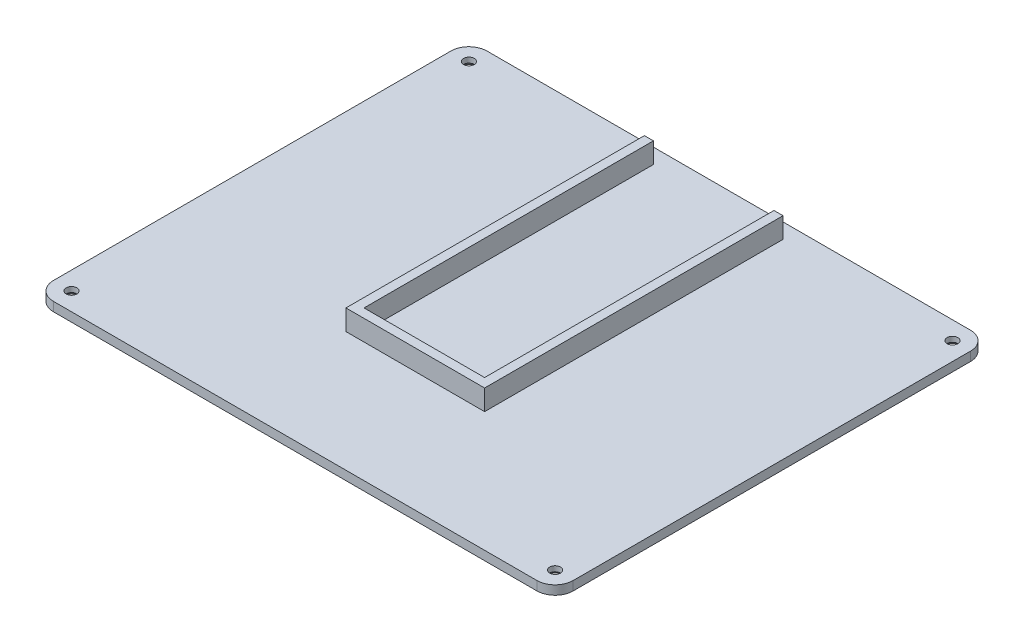
from build123d import *

# Parameters (mm, degrees)
SKETCH1_W                      = 86.201
SKETCH1_H                      = 71.913
BOSS_EXTRUDE1_DEPTH            = 1.5
FILLET1_R                      = 3
F_2_56_TAPPED_HOLE1_AT_2_COUNT = 2
F_2_56_TAPPED_HOLE1_AT_2_PITCH = 80.201
F_2_56_TAPPED_HOLE1_AT_3_COUNT = 2
F_2_56_TAPPED_HOLE1_AT_3_PITCH = 103.811001199
F_2_56_TAPPED_HOLE1_AT_4_COUNT = 2
F_2_56_TAPPED_HOLE1_AT_4_PITCH = 65.913
BOSS_EXTRUDE2_DEPTH            = 3.4


with BuildPart() as part:
    # Sketch1 → Boss-Extrude1 (new body)
    with BuildSketch(Plane(origin=(0, 0, 0), x_dir=(1, 0, 0), z_dir=(0, 1, 0))):
        Rectangle(SKETCH1_W, SKETCH1_H)
    extrude(amount=BOSS_EXTRUDE1_DEPTH)

    # Fillet1
    fillet1_edges = [part.edges().sort_by_distance(p)[0] for p in [
        (-43.1005, 0.75, 35.9565),
        (-43.1005, 0.75, -35.9565),
        (43.1005, 0.75, -35.9565),
        (43.1005, 0.75, 35.9565),
    ]]
    fillet(fillet1_edges, radius=FILLET1_R)

    # Sketch4 → #2-56 Tapped Hole1 (revolve, cut)
    with BuildSketch(Plane(origin=(-40.1005, 0, 32.9565), x_dir=(0, 0, -1), z_dir=(1, 0, 0))):
        Polygon((0, 0), (0, 1.5), (0.889, 1.5), (0.889, 0.635), (1.524, 0), align=None)
    f_2_56_tapped_hole1 = revolve(axis=Axis((-40.1005, -6.35, 32.9565), (0, 1, 0)), mode=Mode.SUBTRACT)

    # #2-56 Tapped Hole1 at 2: #2-56 Tapped Hole1 ×2
    with Locations(*[(i * F_2_56_TAPPED_HOLE1_AT_2_PITCH, 0, 0) for i in range(1, F_2_56_TAPPED_HOLE1_AT_2_COUNT)]):
        add(f_2_56_tapped_hole1, mode=Mode.SUBTRACT)

    # #2-56 Tapped Hole1 at 3: #2-56 Tapped Hole1 ×2
    with Locations(*[Vector(0.7725674453907951, 0, -0.634932706924396) * (i * F_2_56_TAPPED_HOLE1_AT_3_PITCH) for i in range(1, F_2_56_TAPPED_HOLE1_AT_3_COUNT)]):
        add(f_2_56_tapped_hole1, mode=Mode.SUBTRACT)

    # #2-56 Tapped Hole1 at 4: #2-56 Tapped Hole1 ×2
    with Locations(*[(0, 0, -i * F_2_56_TAPPED_HOLE1_AT_4_PITCH) for i in range(1, F_2_56_TAPPED_HOLE1_AT_4_COUNT)]):
        add(f_2_56_tapped_hole1, mode=Mode.SUBTRACT)

    # Sketch5 → Boss-Extrude2 (add)
    with BuildSketch(Plane(origin=(0, 1.5, 0), x_dir=(1, 0, 0), z_dir=(0, 1, 0))):
        Polygon((-10, -14.5435), (-10, 33.4565), (-11.5, 33.4565), (-11.5, -16.0435), (11.5, -16.0435), (11.5, 33.4565), (10, 33.4565), (10, -14.5435), align=None)
    extrude(amount=BOSS_EXTRUDE2_DEPTH)


solid = part.part
